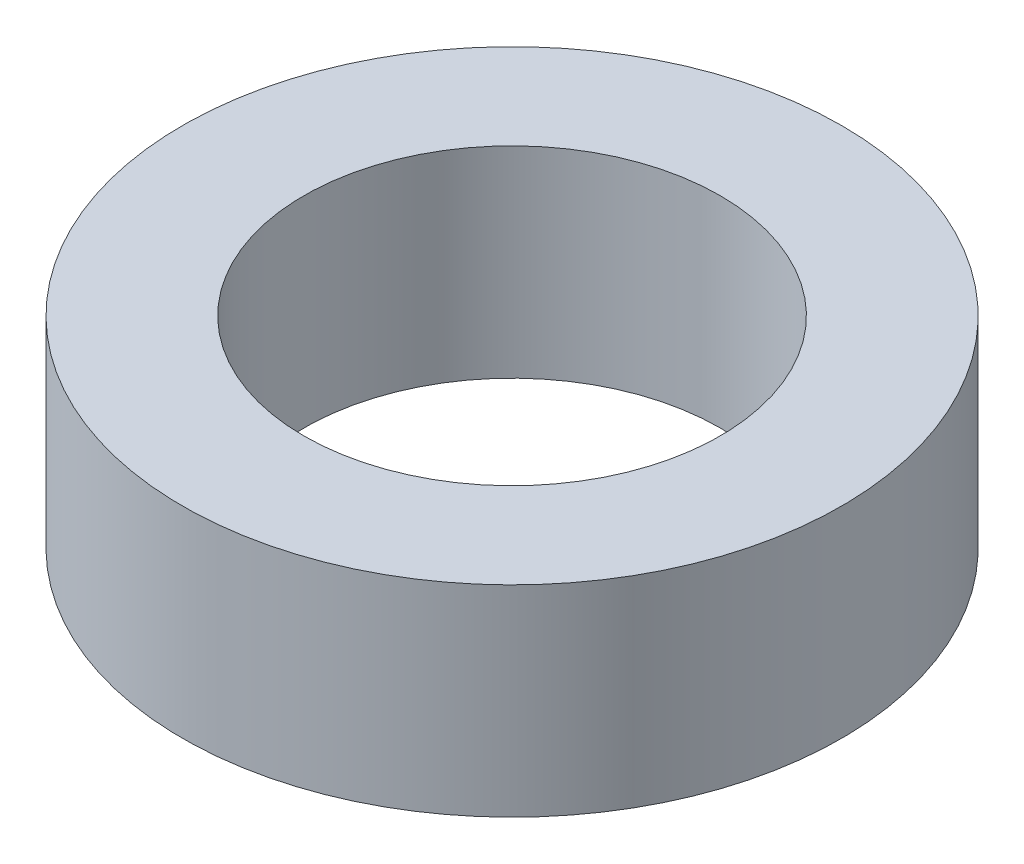
from build123d import *

# Parameters (mm, degrees)
SKETCH1_R           = 47.5
BOSS_EXTRUDE1_DEPTH = 29
SKETCH2_R           = 30
CUT_EXTRUDE1_DEPTH  = 74.167615787


with BuildPart() as part:
    # Sketch1 → Boss-Extrude1 (new body)
    with BuildSketch(Plane(origin=(0, 0, 0), x_dir=(1, 0, 0), z_dir=(0, 1, 0))):
        Circle(SKETCH1_R)
    extrude(amount=BOSS_EXTRUDE1_DEPTH)

    # Sketch2 → Cut-Extrude1 (cut, through all)
    with BuildSketch(Plane(origin=(0, 0, 0), x_dir=(1, 0, 0), z_dir=(0, 1, 0))):
        Circle(SKETCH2_R)
    extrude(amount=CUT_EXTRUDE1_DEPTH, mode=Mode.SUBTRACT)


solid = part.part
